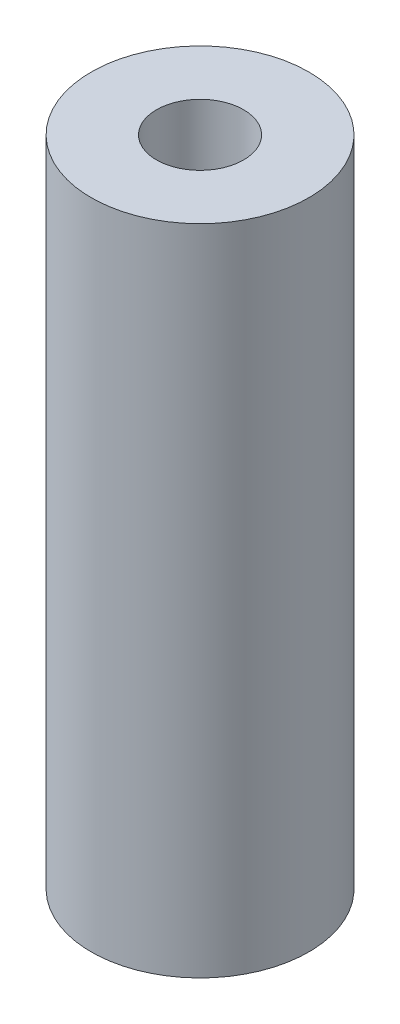
from build123d import *

# Parameters (mm, degrees)
SKETCH1_R           = 7.5
SKETCH1_R_2         = 3
BOSS_EXTRUDE1_DEPTH = 45


with BuildPart() as part:
    # Sketch1 → Boss-Extrude1 (new body)
    with BuildSketch(Plane(origin=(0, 0, 0), x_dir=(1, 0, 0), z_dir=(0, 1, 0))):
        Circle(SKETCH1_R)
        Circle(SKETCH1_R_2, mode=Mode.SUBTRACT)
    extrude(amount=BOSS_EXTRUDE1_DEPTH)


solid = part.part
